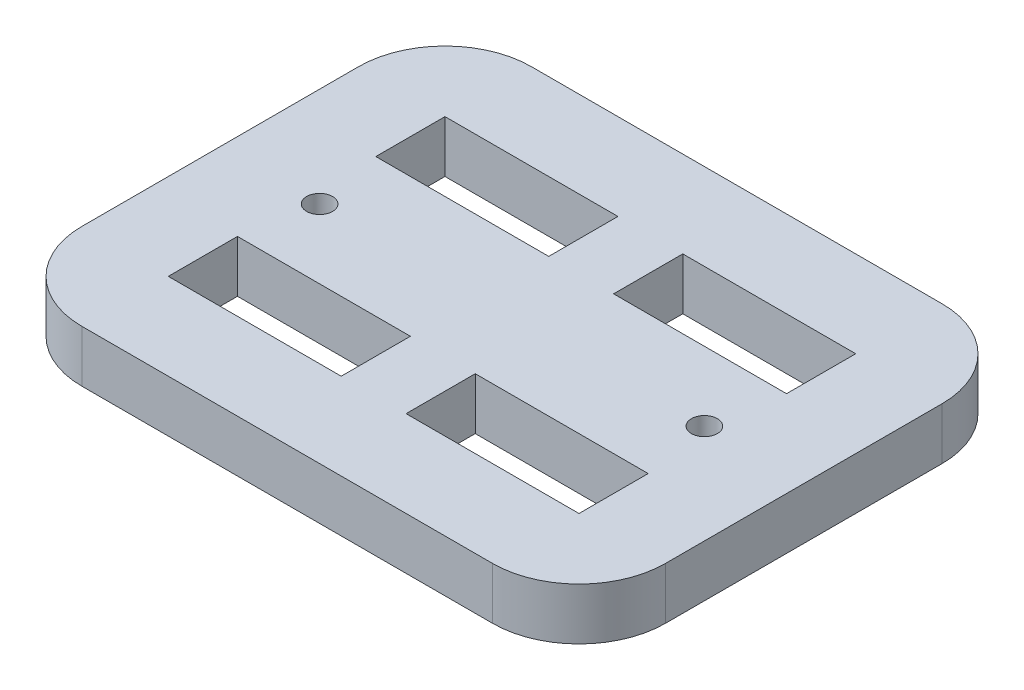
from build123d import *

# Parameters (mm, degrees)
SKETCH1_W            = 33.75
SKETCH1_H            = 52
SKETCH1_R            = 1.5
SKETCH1_W_2          = 20
SKETCH1_H_2          = 8
BOSS_EXTRUDE1_DEPTH  = 6
FILLET1_R            = 10
FILLET1_OF_MIRROR1_R = 10


with BuildPart() as part:
    # Sketch1 → Boss-Extrude1 (new body)
    with BuildSketch(Plane(origin=(0, 0, 0), x_dir=(1, 0, 0), z_dir=(0, 1, 0))):
        with Locations((-16.875, 0)):
            Rectangle(SKETCH1_W, SKETCH1_H)
        with Locations((-22.25, 0)):
            Circle(SKETCH1_R, mode=Mode.SUBTRACT)
        with Locations((-13.75, 12)):
            Rectangle(SKETCH1_W_2, SKETCH1_H_2, mode=Mode.SUBTRACT)
        with Locations((-13.75, -12)):
            Rectangle(SKETCH1_W_2, SKETCH1_H_2, mode=Mode.SUBTRACT)
    boss_extrude1 = extrude(amount=BOSS_EXTRUDE1_DEPTH)

    # Fillet1
    fillet1_edges = [part.edges().sort_by_distance(p)[0] for p in [
        (-33.75, 3, -26),
        (-33.75, 3, 26),
    ]]
    fillet(fillet1_edges, radius=FILLET1_R)

    # Mirror1: Boss-Extrude1 across plane
    add(boss_extrude1.mirror(Plane(origin=(0, 6, -26), x_dir=(0, 0, 1), z_dir=(-1, 0, 0))))

    # Fillet1 of Mirror1
    fillet1_of_mirror1_edges = [part.edges().sort_by_distance(p)[0] for p in [
        (33.75, 3, -26),
        (33.75, 3, 26),
    ]]
    fillet(fillet1_of_mirror1_edges, radius=FILLET1_OF_MIRROR1_R)


solid = part.part
